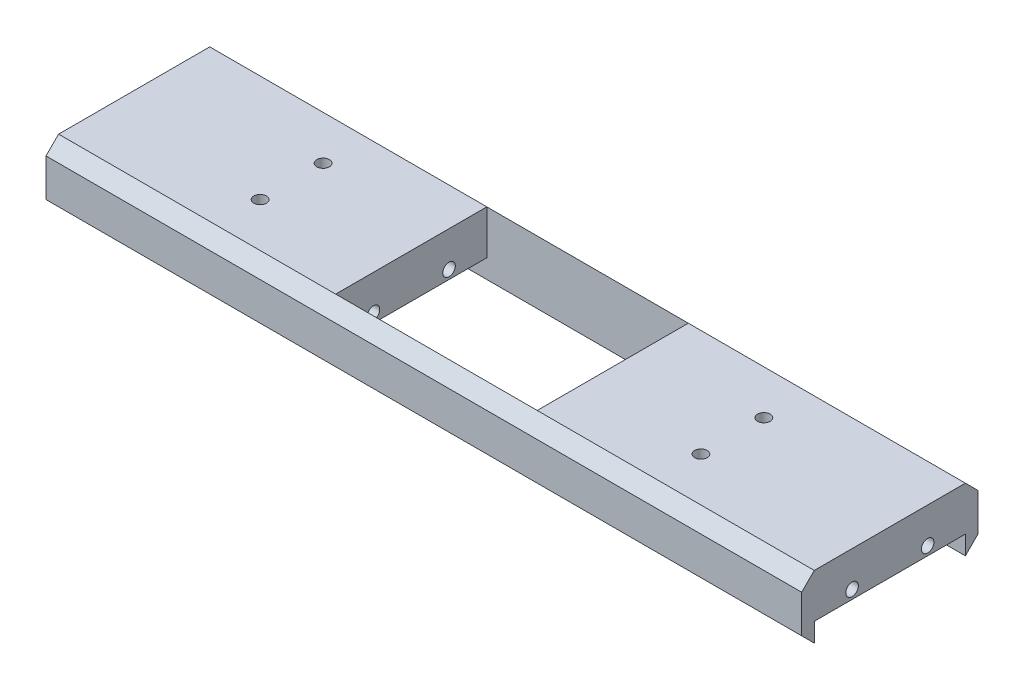
from build123d import *

# Parameters (mm, degrees)
SKETCH_1_W          = 60
SKETCH_1_H          = 14
EXTRUDE_1_DEPTH     = 5
SKETCH_2_W          = 16
SKETCH_2_H          = 12
CUT_EXTRUDE_1_DEPTH = 32.208973069
SKETCH_3_R          = 0.5
CUT_EXTRUDE_2_DEPTH = 61.613529843
SKETCH_4_W          = 22
SKETCH_4_H          = 12
CUT_EXTRUDE_3_DEPTH = 1.5
CHAMFER_1_SIZE      = 1
CHAMFER_2_SIZE      = 1
CHAMFER_3_SIZE      = 1
SKETCH_5_R          = 0.5
CUT_EXTRUDE_4_DEPTH = 32.208973069


with BuildPart() as part:
    # 草图1 → 凸台-拉伸1 (new body)
    with BuildSketch(Plane(origin=(0, 0, 0), x_dir=(1, 0, 0), z_dir=(0, 1, 0))):
        Rectangle(SKETCH_1_W, SKETCH_1_H)
    extrude(amount=EXTRUDE_1_DEPTH)

    # 草图2 → 切除-拉伸1 (cut, through all)
    with BuildSketch(Plane(origin=(0, 5, 0), x_dir=(1, 0, 0), z_dir=(0, 1, 0))):
        Rectangle(SKETCH_2_W, SKETCH_2_H)
    extrude(amount=-CUT_EXTRUDE_1_DEPTH, mode=Mode.SUBTRACT)

    # 草图3 → 切除-拉伸2 (cut, through all)
    with BuildSketch(Plane.ZY.offset(30)):
        with Locations((-3, 2.2)):
            Circle(SKETCH_3_R)
        with Locations(Location((3, 2.2, 0), (0, 0, 180))):
            Circle(SKETCH_3_R)
    extrude(amount=-CUT_EXTRUDE_2_DEPTH, mode=Mode.SUBTRACT)

    # 草图4 → 切除-拉伸3 (cut)
    with BuildSketch(Plane.XZ):
        with Locations((-19, 0)):
            Rectangle(SKETCH_4_W, SKETCH_4_H)
        with Locations((19, 0)):
            Rectangle(SKETCH_4_W, SKETCH_4_H)
    extrude(amount=-CUT_EXTRUDE_3_DEPTH, mode=Mode.SUBTRACT)

    # 倒角1
    chamfer_1_edges = [part.edges().sort_by_distance(p)[0] for p in [
        (0, 5, -7),
        (0, 5, 7),
    ]]
    chamfer(chamfer_1_edges, length=CHAMFER_1_SIZE - 0.0001)  # a hair under: the kernel refuses the full size

    # 倒角2
    chamfer_2_edges = [part.edges().sort_by_distance(p)[0] for p in [
        (0, 0, 7),
    ]]
    chamfer(chamfer_2_edges, length=CHAMFER_2_SIZE - 0.0001)  # a hair under: the kernel refuses the full size

    # 倒角3
    chamfer_3_edges = [part.edges().sort_by_distance(p)[0] for p in [
        (0, 0, -7),
    ]]
    chamfer(chamfer_3_edges, length=CHAMFER_3_SIZE - 0.0001)  # a hair under: the kernel refuses the full size

    # 草图5 → 切除-拉伸4 (cut, through all)
    with BuildSketch(Plane(origin=(0, 5, 0), x_dir=(1, 0, 0), z_dir=(0, 1, 0))):
        with Locations(Location((-17.5, 2.5, 0), (0, 0, 270))):
            Circle(SKETCH_5_R)
        with Locations(Location((17.5, 2.5, 0), (0, 0, 270))):
            Circle(SKETCH_5_R)
        with Locations(Location((17.5, -2.5, 0), (0, 0, 270))):
            Circle(SKETCH_5_R)
        with Locations(Location((-17.5, -2.5, 0), (0, 0, 90))):
            Circle(SKETCH_5_R)
    extrude(amount=-CUT_EXTRUDE_4_DEPTH, mode=Mode.SUBTRACT)


solid = part.part
